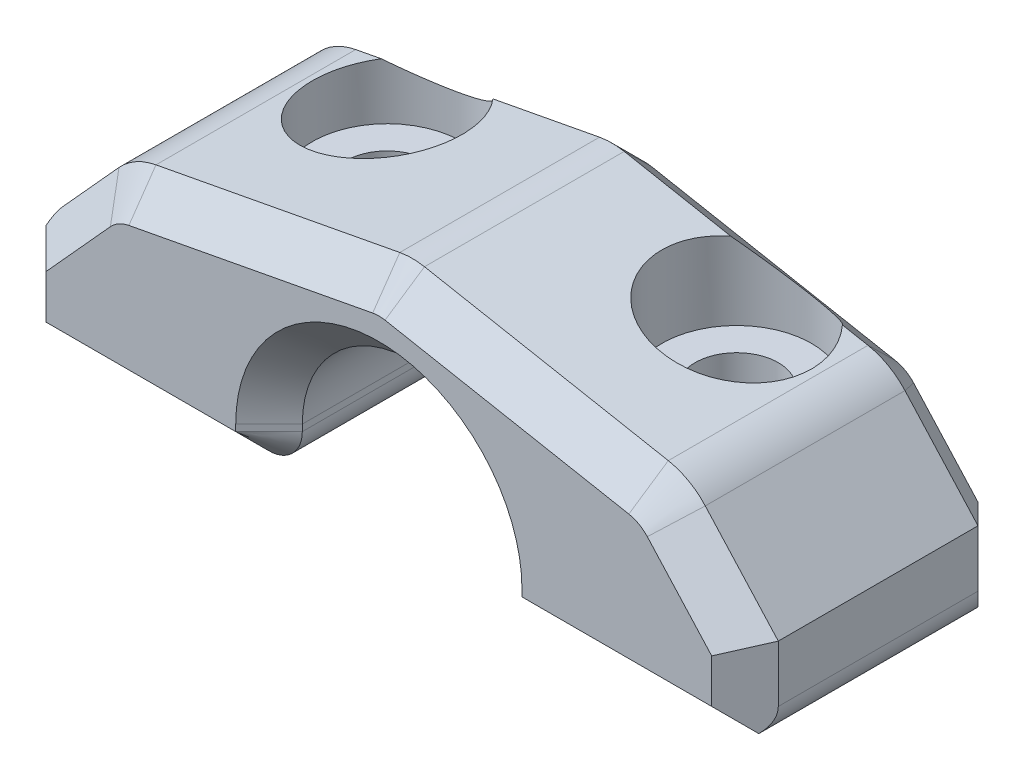
from build123d import *

# Parameters (mm, degrees)
BOSS_EXTRUDE1_DEPTH     = 8
CUT_EXTRUDE1_DEPTH      = 15.866068747
CUT_EXTRUDE1_DEPTH_BACK = 15.866068747
SKETCH3_W               = 7.7
SKETCH3_H               = 1.196323822
BOSS_EXTRUDE2_DEPTH     = 8
CHAMFER1_SIZE           = 1
FILLET1_R               = 1
SKETCH4_R               = 1.25
CUT_EXTRUDE2_DEPTH      = 16.387887332
CUT_EXTRUDE3_START      = 3
SKETCH5_R               = 2.25
CUT_EXTRUDE3_DEPTH      = 10
FILLET2_R               = 2
FILLET3_R               = 1
CHAMFER2_SIZE           = 1


# Some blends are built 0.0001 mm under size
with BuildPart() as part:
    # Sketch1 → Boss-Extrude1 (new body)
    with BuildSketch(Plane.XY):
        with BuildLine():
            Line((-3.3, 0), (-11, 0))
            Line((-11, 0), (-11, 6))
            Line((-11, 6), (11, 6))
            Line((11, 6), (11, 0))
            Line((11, 0), (3.3, 0))
            ThreePointArc((3.3, 0), (0, 3.3), (-3.3, 0))
        make_face()
    extrude(amount=BOSS_EXTRUDE1_DEPTH)

    # Sketch2 → Cut-Extrude1 (cut, two sides: drawn at the far end of the back side and taken through both)
    with BuildSketch(Plane.XY.offset(8).offset(-CUT_EXTRUDE1_DEPTH_BACK)):
        Polygon((-8.355690819, 4.422930452), (0, 6), (-11, 6), (-11, 1.504439372), align=None)
        Polygon((11, 6), (0, 6), (8.355690819, 4.422930452), (11, 1.504439372), align=None)
    extrude(amount=CUT_EXTRUDE1_DEPTH + CUT_EXTRUDE1_DEPTH_BACK, mode=Mode.SUBTRACT)

    # Sketch3 → Boss-Extrude2 (add)
    with BuildSketch(Plane.XY.offset(8)):
        with Locations((-7.15, -0.598161911)):
            Rectangle(SKETCH3_W, SKETCH3_H)
        with Locations((7.15, -0.598161911)):
            Rectangle(SKETCH3_W, SKETCH3_H)
    extrude(amount=-BOSS_EXTRUDE2_DEPTH)

    # Chamfer1
    chamfer1_edges = [part.edges().sort_by_distance(p)[0] for p in [
        (11, 0.154057775, 8),
        (-11, 0.154057775, 0),
        (-11, 0.154057775, 8),
        (11, 0.154057775, 0),
    ]]
    chamfer(chamfer1_edges, length=CHAMFER1_SIZE)

    # Fillet1
    fillet1_edges = [part.edges().sort_by_distance(p)[0] for p in [
        (-3.3, -1.196323822, 4),
        (3.3, -1.196323822, 4),
    ]]
    fillet(fillet1_edges, radius=FILLET1_R)

    # Sketch4 → Cut-Extrude2 (cut, through all)
    with BuildSketch(Plane.XZ.offset(1.196323822)):
        with Locations(Location((-5.25, 2.5, 0), (0, 0, 319.464197889))):
            Circle(SKETCH4_R)
        with Locations((5.25, 2.5)):
            Circle(SKETCH4_R)
    extrude(amount=-CUT_EXTRUDE2_DEPTH, mode=Mode.SUBTRACT)

    # Sketch5 → Cut-Extrude3 (cut)
    with BuildSketch(Plane(origin=(0, 0, 0), x_dir=(1, 0, 0), z_dir=(0, 1, 0)).offset(CUT_EXTRUDE3_START)):
        with Locations(Location((-5.25, -2.5, 0), (0, 0, 180))):
            Circle(SKETCH5_R)
        with Locations((5.25, -2.5)):
            Circle(SKETCH5_R)
    extrude(amount=CUT_EXTRUDE3_DEPTH, mode=Mode.SUBTRACT)

    # Fillet2
    fillet2_edges = [part.edges().sort_by_distance(p)[0] for p in [
        (8.355690819, 4.422930452, 4),
        (-8.355690819, 4.422930452, 4),
        (0, 6, 4),
        (-11, 1.504439372, 4),
    ]]
    fillet(fillet2_edges, radius=FILLET2_R)

    # Fillet3
    fillet3_edges = [part.edges().sort_by_distance(p)[0] for p in [
        (11, -1.196323822, 4),
        (-11, -1.196323822, 4),
    ]]
    fillet(fillet3_edges, radius=FILLET3_R)

    # Chamfer2
    chamfer2_edges = [part.edges().sort_by_distance(p)[0] for p in [
        (7.15, -1.196323822, 8),
        (3.592893219, -0.903430603, 8),
        (3.3, -0.098161911, 8),
        (0, 3.3, 8),
        (-3.3, -0.098161911, 8),
        (-3.592893219, -0.903430603, 8),
        (-7.15, -1.196323822, 8),
    ]]
    chamfer(chamfer2_edges, length=CHAMFER2_SIZE - 0.0001)  # a hair under: the kernel refuses the full size
    chamfer2_2_edges = [part.edges().sort_by_distance(p)[0] for p in [
        (7.15, -1.196323822, 0),
        (3.592893219, -0.903430603, 0),
        (3.3, -0.098161911, 0),
        (0, 3.3, 0),
        (-3.3, -0.098161911, 0),
        (-3.592893219, -0.903430603, 0),
        (-7.15, -1.196323822, 0),
    ]]
    chamfer(chamfer2_2_edges, length=CHAMFER2_SIZE - 0.0001)  # a hair under: the kernel refuses the full size
    # the kernel refuses this chamfer: 1 mm, written as the material it takes off along each edge
    with BuildSketch(Plane(origin=(8.806750236, 3.925101796, 0), x_dir=(-0.7407792072905057, -0.6711856247085939, -0.02749587661058639), z_dir=(0.6714394846228174, -0.7410593893133298, 0)), Plane(origin=(-11.7267295, 0.702357082, 0), x_dir=(0.7407792072905062, -0.6711856247085936, -0.02749587661058639), z_dir=(0.6714394846228171, 0.7410593893133303, 0))) as chamfer2_3_piece_1:
        with BuildLine():
            Line((1.028673195, 0), (-0.056547155, -1.027117794))
            Line((-0.056547155, -1.027117794), (-0.076539593, -1.026567876))
            ThreePointArc((-0.076539593, -1.026567876), (-0.034129227, -0.51339783), (-0.019992438, 0.000549918))
            Line((-0.019992438, 0.000549918), (0.000549918, 0.019992438))
            ThreePointArc((0.000549918, 0.019992438), (0.514497665, 0.00585565), (1.029223113, 0.019992438))
            Line((1.029223113, 0.019992438), (1.028673195, 0))
        make_face()
    extrude(amount=4.348834602, mode=Mode.SUBTRACT)
    with BuildSketch(Plane(origin=(7.324631458, 2.582222827, 0), x_dir=(0.7410593893133297, 0.6714394846228176, 0), z_dir=(0.6714394846228176, -0.7410593893133297, 0))) as chamfer2_3_piece_2:
        with BuildLine():
            Line((0.971715729, -0.028284271), (2.028284271, 1.028284271))
            Line((2.028284271, 1.028284271), (2.048284271, 1.028284271))
            ThreePointArc((2.048284271, 1.028284271), (2.02, 0.514142136), (2.02, 0))
            Line((2.02, 0), (2, -0.02))
            ThreePointArc((2, -0.02), (1.485857864, -0.02), (0.971715729, -0.048284271))
            Line((0.971715729, -0.048284271), (0.971715729, -0.028284271))
        make_face()
    revolve(axis=Axis((7.324631458, 2.582222827, 0), (0, 0, 1)), revolution_arc=37.133354948, mode=Mode.SUBTRACT)
    with BuildSketch(Plane(origin=(0.370934753, 5.929989044, 0), x_dir=(-0.18539725465470863, -0.9822788986514536, -0.02749587661058548), z_dir=(0.9826504221581788, -0.1854673767333577, 0)), Plane(origin=(-7.695566211, 4.547523671, 0), x_dir=(0.18539725465470863, -0.9822788986514536, -0.0274958766105855), z_dir=(0.9826504221581788, 0.1854673767333577, 0))) as chamfer2_3_piece_3:
        with BuildLine():
            Line((1.028673195, 0), (-0.056547155, -1.027117794))
            Line((-0.056547155, -1.027117794), (-0.076539593, -1.026567876))
            ThreePointArc((-0.076539593, -1.026567876), (-0.034129227, -0.51339783), (-0.019992438, 0.000549918))
            Line((-0.019992438, 0.000549918), (0.000549918, 0.019992438))
            ThreePointArc((0.000549918, 0.019992438), (0.514497665, 0.00585565), (1.029223113, 0.019992438))
            Line((1.029223113, 0.019992438), (1.028673195, 0))
        make_face()
    extrude(amount=7.45395442, mode=Mode.SUBTRACT)
    with BuildSketch(Plane(origin=(0, 3.964688199, 0), x_dir=(0.1854673767333581, 0.9826504221581787, 0), z_dir=(0.9826504221581787, -0.1854673767333581, 0))) as chamfer2_3_piece_4:
        with BuildLine():
            Line((0.971715729, -0.028284271), (2.028284271, 1.028284271))
            Line((2.028284271, 1.028284271), (2.048284271, 1.028284271))
            ThreePointArc((2.048284271, 1.028284271), (2.02, 0.514142136), (2.02, 0))
            Line((2.02, 0), (2, -0.02))
            ThreePointArc((2, -0.02), (1.485857864, -0.02), (0.971715729, -0.048284271))
            Line((0.971715729, -0.048284271), (0.971715729, -0.028284271))
        make_face()
    revolve(axis=Axis((0, 3.964688199, 0), (0, 0, 1)), revolution_arc=21.376765384, mode=Mode.SUBTRACT)
    with BuildSketch(Plane(origin=(-7.324631458, 2.582222827, 0), x_dir=(-0.1854673767333579, 0.9826504221581787, 0), z_dir=(0.9826504221581787, 0.1854673767333579, 0))) as chamfer2_3_piece_5:
        with BuildLine():
            Line((0.971715729, -0.028284271), (2.028284271, 1.028284271))
            Line((2.028284271, 1.028284271), (2.048284271, 1.028284271))
            ThreePointArc((2.048284271, 1.028284271), (2.02, 0.514142136), (2.02, 0))
            Line((2.02, 0), (2, -0.02))
            ThreePointArc((2, -0.02), (1.485857864, -0.02), (0.971715729, -0.048284271))
            Line((0.971715729, -0.048284271), (0.971715729, -0.028284271))
        make_face()
    revolve(axis=Axis((-7.324631458, 2.582222827, 0), (0, 0, 1)), revolution_arc=37.133354948, mode=Mode.SUBTRACT)
    # the kernel refuses this chamfer: 1 mm, written as the material it takes off along each edge
    with BuildSketch(Plane(origin=(8.806750236, 3.925101796, 8), x_dir=(-0.7407792072905057, -0.6711856247085939, 0.02749587661058564), z_dir=(0.6714394846228174, -0.7410593893133298, 0)), Plane(origin=(-11.7267295, 0.702357082, 8), x_dir=(0.740779207290506, -0.6711856247085934, 0.027495876610585612), z_dir=(0.6714394846228171, 0.7410593893133303, 0))) as chamfer2_4_piece_1:
        with BuildLine():
            Line((1.028673195, 0), (-0.056547155, 1.027117794))
            Line((-0.056547155, 1.027117794), (-0.076539593, 1.026567876))
            ThreePointArc((-0.076539593, 1.026567876), (-0.034129227, 0.51339783), (-0.019992438, -0.000549918))
            Line((-0.019992438, -0.000549918), (0.000549918, -0.019992438))
            ThreePointArc((0.000549918, -0.019992438), (0.514497665, -0.00585565), (1.029223113, -0.019992438))
            Line((1.029223113, -0.019992438), (1.028673195, 0))
        make_face()
    extrude(amount=4.348834602, mode=Mode.SUBTRACT)
    with BuildSketch(Plane(origin=(7.324631458, 2.582222827, 8), x_dir=(0.7410593893133297, 0.6714394846228176, 0), z_dir=(0.6714394846228176, -0.7410593893133297, 0))) as chamfer2_4_piece_2:
        with BuildLine():
            Line((0.971715729, 0.028284271), (2.028284271, -1.028284271))
            Line((2.028284271, -1.028284271), (2.048284271, -1.028284271))
            ThreePointArc((2.048284271, -1.028284271), (2.02, -0.514142136), (2.02, 0))
            Line((2.02, 0), (2, 0.02))
            ThreePointArc((2, 0.02), (1.485857864, 0.02), (0.971715729, 0.048284271))
            Line((0.971715729, 0.048284271), (0.971715729, 0.028284271))
        make_face()
    revolve(axis=Axis((7.324631458, 2.582222827, 8), (0, 0, 1)), revolution_arc=37.133354948, mode=Mode.SUBTRACT)
    with BuildSketch(Plane(origin=(0.370934753, 5.929989044, 8), x_dir=(-0.18539725465470863, -0.9822788986514536, 0.027495876610585605), z_dir=(0.9826504221581788, -0.1854673767333577, 0)), Plane(origin=(-7.695566211, 4.547523671, 8), x_dir=(0.18539725465470863, -0.9822788986514536, 0.02749587661058563), z_dir=(0.9826504221581788, 0.1854673767333577, 0))) as chamfer2_4_piece_3:
        with BuildLine():
            Line((1.028673195, 0), (-0.056547155, 1.027117794))
            Line((-0.056547155, 1.027117794), (-0.076539593, 1.026567876))
            ThreePointArc((-0.076539593, 1.026567876), (-0.034129227, 0.51339783), (-0.019992438, -0.000549918))
            Line((-0.019992438, -0.000549918), (0.000549918, -0.019992438))
            ThreePointArc((0.000549918, -0.019992438), (0.514497665, -0.00585565), (1.029223113, -0.019992438))
            Line((1.029223113, -0.019992438), (1.028673195, 0))
        make_face()
    extrude(amount=7.45395442, mode=Mode.SUBTRACT)
    with BuildSketch(Plane(origin=(0, 3.964688199, 8), x_dir=(0.1854673767333581, 0.9826504221581787, 0), z_dir=(0.9826504221581787, -0.1854673767333581, 0))) as chamfer2_4_piece_4:
        with BuildLine():
            Line((0.971715729, 0.028284271), (2.028284271, -1.028284271))
            Line((2.028284271, -1.028284271), (2.048284271, -1.028284271))
            ThreePointArc((2.048284271, -1.028284271), (2.02, -0.514142136), (2.02, 0))
            Line((2.02, 0), (2, 0.02))
            ThreePointArc((2, 0.02), (1.485857864, 0.02), (0.971715729, 0.048284271))
            Line((0.971715729, 0.048284271), (0.971715729, 0.028284271))
        make_face()
    revolve(axis=Axis((0, 3.964688199, 8), (0, 0, 1)), revolution_arc=21.376765384, mode=Mode.SUBTRACT)
    with BuildSketch(Plane(origin=(-7.324631458, 2.582222827, 8), x_dir=(-0.1854673767333579, 0.9826504221581787, 0), z_dir=(0.9826504221581787, 0.1854673767333579, 0))) as chamfer2_4_piece_5:
        with BuildLine():
            Line((0.971715729, 0.028284271), (2.028284271, -1.028284271))
            Line((2.028284271, -1.028284271), (2.048284271, -1.028284271))
            ThreePointArc((2.048284271, -1.028284271), (2.02, -0.514142136), (2.02, 0))
            Line((2.02, 0), (2, 0.02))
            ThreePointArc((2, 0.02), (1.485857864, 0.02), (0.971715729, 0.048284271))
            Line((0.971715729, 0.048284271), (0.971715729, 0.028284271))
        make_face()
    revolve(axis=Axis((-7.324631458, 2.582222827, 8), (0, 0, 1)), revolution_arc=37.133354948, mode=Mode.SUBTRACT)


solid = part.part
